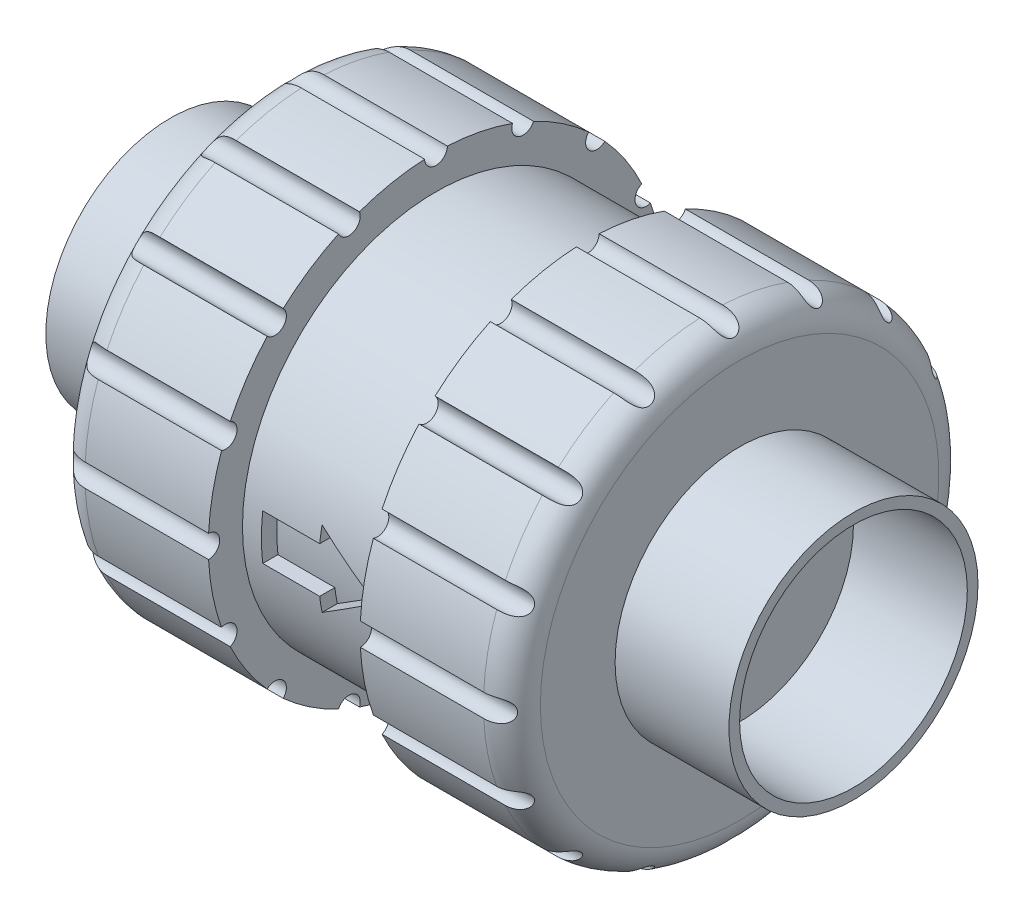
from build123d import *

# Parameters (mm, degrees)
SKETCH_1_R                 = 17.5
SKETCH_1_R_2               = 16
EXTRUDE_1_DEPTH            = 48
EXTRUDE_START              = -16
SKETCH_2_R                 = 32
EXTRUDE_1_2_DEPTH          = 32
CUT_EXTRUDE_START          = -21.333333333
SKETCH_3_OUTSIDE_W         = 86.49
SKETCH_3_OUTSIDE_H         = 86.49
SKETCH_3_OUTSIDE_R         = 27.2
CUT_EXTRUDE_1_DEPTH        = 35.092292509
FILLET_2_R                 = 4
CUT_EXTRUDE_2_REACH        = 57.426
SKETCH_4_R                 = 1.6
PATTERN_CIRCULAR_1_COUNT   = 16
CUT_EXTRUDE_3_REACH        = 70.064
CUT_EXTRUDE_3_START_RADIUS = 27.2
CUT_EXTRUDE_3_END_RADIUS   = 27.2


# Read off the part's stored shape, not the designer's step: Зеркальное отражение2
with BuildPart() as part:
    # Эскиз1 → Extrude 1 (new body)
    with BuildSketch(Plane(origin=(0, 0, 0), x_dir=(0, 0, -1), z_dir=(1, 0, 0))):
        Circle(SKETCH_1_R)
        Circle(SKETCH_1_R_2, mode=Mode.SUBTRACT)
    extrude(amount=-EXTRUDE_1_DEPTH)

    # Эскиз2 → Extrude 1 2 (add)
    with BuildSketch(Plane.ZY.offset(48).offset(EXTRUDE_START)):
        Circle(SKETCH_2_R)
    extrude(amount=-EXTRUDE_1_2_DEPTH)

    # Эскиз3 outside → Вырез-Вытянуть1 (cut, through all)
    with BuildSketch(Plane.ZY.offset(32).offset(CUT_EXTRUDE_START)):
        Rectangle(SKETCH_3_OUTSIDE_W, SKETCH_3_OUTSIDE_H)
        Circle(SKETCH_3_OUTSIDE_R, mode=Mode.SUBTRACT)
    extrude(amount=-CUT_EXTRUDE_1_DEPTH, mode=Mode.SUBTRACT)

    # Скругление2
    fillet_2_edges = [part.edges().sort_by_distance(p)[0] for p in [
        (-32, 0, -32),
    ]]
    fillet(fillet_2_edges, radius=FILLET_2_R)

    # Эскиз4 → Вырез-Вытянуть2 (cut, up to next)
    with BuildSketch(Plane.ZY.offset(32), mode=Mode.PRIVATE) as cut_extrude_2_sk1:
        with Locations((0, 32)):
            Circle(SKETCH_4_R)
    cut_extrude_2_tool1 = extrude(cut_extrude_2_sk1.sketch, amount=-CUT_EXTRUDE_2_REACH, mode=Mode.PRIVATE) & part.part
    cut_extrude_2 = cut_extrude_2_tool1.solids().sort_by_distance((-32, 32, 0))[0]
    add(cut_extrude_2, mode=Mode.SUBTRACT)

    # Круговой массив1: Вырез-Вытянуть2 ×16 about axis
    pattern_circular_1_axis = Axis((0, 0, 0), (1, 0, 0))
    for i in range(1, PATTERN_CIRCULAR_1_COUNT):
        add(cut_extrude_2.rotate(pattern_circular_1_axis, i * 360 / PATTERN_CIRCULAR_1_COUNT), mode=Mode.SUBTRACT)

    # Зеркальное отражение2: part across plane


with BuildPart() as part_1:
    add(part.part)
    add(part.part.mirror(Plane(origin=(0, 0, 0), x_dir=(0, 0, 1), z_dir=(1, 0, 0))))

    # Вырез-Вытянуть3: from a cylinder face, 70.064 long prism both ways, kept between that surface and its translate by the depth
    cut_extrude_3_start = Plane(origin=(-0.969697, 0, 0), z_dir=(-1, 0, 0)) * Cylinder(CUT_EXTRUDE_3_START_RADIUS, 195.528, mode=Mode.PRIVATE)
    cut_extrude_3_end = Plane(origin=(-0.969697, 0, -2.133333333), z_dir=(-1, 0, 0)) * Cylinder(CUT_EXTRUDE_3_END_RADIUS, 195.528, mode=Mode.PRIVATE)
    # Эскиз5 → Вырез-Вытянуть3 (cut, from a surface)
    with BuildSketch(Plane.XY, mode=Mode.PRIVATE) as cut_extrude_3_sk1:
        Polygon((-8, -3.2), (-8, 3.2), (0, 3.2), (0, 5.333333333), (8, 0), (0, -5.333333333), (0, -3.2), align=None)
    cut_extrude_3_tool1 = extrude(cut_extrude_3_sk1.sketch, amount=CUT_EXTRUDE_3_REACH, both=True, mode=Mode.PRIVATE)
    add(((cut_extrude_3_tool1 & cut_extrude_3_start) - cut_extrude_3_end).solids().sort_by_distance((-0.969697, 0, 25.869333))[0], mode=Mode.SUBTRACT)


solid = part_1.part
